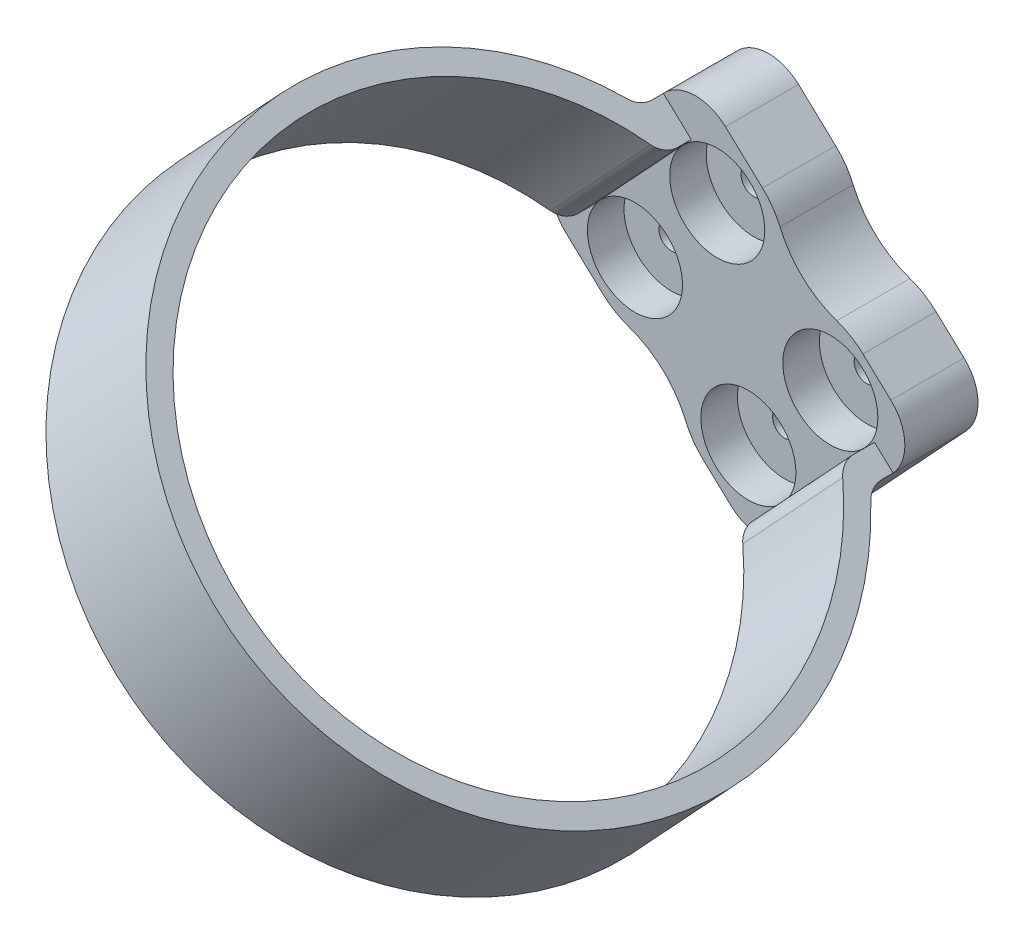
from build123d import *
from build123d.topology import SkipClean

# Parameters (mm, degrees)
BOSS_EXTRUDE2_DEPTH            = 10
SKETCH3_R                      = 40
SKETCH3_R_2                    = 37
BOSS_EXTRUDE3_DEPTH            = 20.040152
CUT_EXTRUDE1_REACH             = 115.803
CUT_EXTRUDE1_END_RADIUS        = 37
SKETCH5_R                      = 1.74703634
SKETCH5_R_2                    = 1.683355043
SKETCH10_W                     = 30.914979244
SKETCH10_H                     = 10
BOSS_EXTRUDE8_DEPTH            = 6
SKETCH11_W                     = 30.914979244
SKETCH11_H                     = 10
BOSS_EXTRUDE9_DEPTH            = 6
SKETCH12_W                     = 10
SKETCH12_H                     = 32.040152213
BOSS_EXTRUDE10_DEPTH           = 6
SKETCH13_W                     = 10
SKETCH13_H                     = 32.040152213
BOSS_EXTRUDE11_DEPTH           = 6
FILLET3_R                      = 6
BOSS_EXTRUDE12_REACH           = 108.364
BOSS_EXTRUDE13_REACH           = 108.364
SKETCH17_R                     = 6.5
CUT_EXTRUDE3_DEPTH             = 5
CUT_EXTRUDE3_DIRECTION_2_REACH = 108.364
CUT_EXTRUDE4_REACH             = 108.364
CUT_EXTRUDE4_END_RADIUS        = 37
FILLET4_R                      = 3
CUT_EXTRUDE5_REACH             = 115.803
FILLET5_R                      = 10


with BuildPart() as part:
    # Sketch1 → Boss-Extrude2 (new body)
    with BuildSketch(Plane.XY):
        Polygon((-3.075119388, 21.362598398), (19.547102475, 0.291978577), (33.205802521, 14.956480402), (10.583580658, 36.027100222), align=None)
    extrude(amount=BOSS_EXTRUDE2_DEPTH)

    # Sketch3 → Boss-Extrude3 (add)
    with BuildSketch(Plane(origin=(22.884598517, 24.569778644, 0), x_dir=(-0.7317560100777086, 0.6815666817818727, 0), z_dir=(0.6815666817818727, 0.7317560100777086, 0))):
        with Locations((1.352782776, 46.892628188)):
            Circle(SKETCH3_R)
        with Locations((1.352782776, 46.892628188)):
            Circle(SKETCH3_R_2, mode=Mode.SUBTRACT)
    extrude(amount=-BOSS_EXTRUDE3_DEPTH)

    # Cut-Extrude1: up to this cylinder (the profile starts outside it)
    cut_extrude1_end = Plane(origin=(15.043707154, 18.136311869, 46.892628188), z_dir=(0.6815666817818727, 0.7317560100777086, 0)) * Cylinder(CUT_EXTRUDE1_END_RADIUS, 323.139339437, mode=Mode.PRIVATE)
    # Sketch5 → Cut-Extrude1 (cut, up to the surface)
    with BuildSketch(Plane(origin=(0, 0, 0), x_dir=(-1, 0, 0), z_dir=(0, 0, -1)), mode=Mode.PRIVATE) as cut_extrude1_sk1:
        with Locations((-13.552748015, 30.82203985)):
            Circle(SKETCH5_R)
    cut_extrude1_tool1 = extrude(cut_extrude1_sk1.sketch, amount=-CUT_EXTRUDE1_REACH, mode=Mode.PRIVATE) - cut_extrude1_end
    add(cut_extrude1_tool1.solids().sort_by_distance((13.552748, 30.82204, 0))[0], mode=Mode.SUBTRACT)
    # Sketch5 → Cut-Extrude1 (cut, up to the surface)
    with BuildSketch(Plane(origin=(0, 0, 0), x_dir=(-1, 0, 0), z_dir=(0, 0, -1)), mode=Mode.PRIVATE) as cut_extrude1_sk2:
        with Locations((-2.306822594, 18.748043967)):
            Circle(SKETCH5_R)
    cut_extrude1_tool2 = extrude(cut_extrude1_sk2.sketch, amount=-CUT_EXTRUDE1_REACH, mode=Mode.PRIVATE) - cut_extrude1_end
    add(cut_extrude1_tool2.solids().sort_by_distance((2.306823, 18.748044, 0))[0], mode=Mode.SUBTRACT)
    # Sketch5 → Cut-Extrude1 (cut, up to the surface)
    with BuildSketch(Plane(origin=(0, 0, 0), x_dir=(-1, 0, 0), z_dir=(0, 0, -1)), mode=Mode.PRIVATE) as cut_extrude1_sk3:
        with Locations((-17.810962495, 4.261826269)):
            Circle(SKETCH5_R_2)
    cut_extrude1_tool3 = extrude(cut_extrude1_sk3.sketch, amount=-CUT_EXTRUDE1_REACH, mode=Mode.PRIVATE) - cut_extrude1_end
    add(cut_extrude1_tool3.solids().sort_by_distance((17.810962, 4.261826, 0))[0], mode=Mode.SUBTRACT)
    # Sketch5 → Cut-Extrude1 (cut, up to the surface)
    with BuildSketch(Plane(origin=(0, 0, 0), x_dir=(-1, 0, 0), z_dir=(0, 0, -1)), mode=Mode.PRIVATE) as cut_extrude1_sk4:
        with Locations((-29.017899523, 16.394033311)):
            Circle(SKETCH5_R)
    cut_extrude1_tool4 = extrude(cut_extrude1_sk4.sketch, amount=-CUT_EXTRUDE1_REACH, mode=Mode.PRIVATE) - cut_extrude1_end
    add(cut_extrude1_tool4.solids().sort_by_distance((29.0179, 16.394033, 0))[0], mode=Mode.SUBTRACT)

    # Sketch10 → Boss-Extrude8 (add)
    with BuildSketch(Plane(origin=(9.22589847, 9.905276819, 0), x_dir=(0.7317560100777085, -0.6815666817818729, 0), z_dir=(-0.6815666817818729, -0.7317560100777085, 0))):
        with Locations((-1.352782776, 5)):
            Rectangle(SKETCH10_W, SKETCH10_H)
    extrude(amount=BOSS_EXTRUDE8_DEPTH)

    # Sketch11 → Boss-Extrude9 (add)
    with BuildSketch(Plane(origin=(22.884598517, 24.569778644, 0), x_dir=(0.7317560100777083, -0.681566681781873, 0), z_dir=(0.681566681781873, 0.7317560100777083, 0))):
        with Locations((-1.352782776, -5)):
            Rectangle(SKETCH11_W, SKETCH11_H)
    extrude(amount=BOSS_EXTRUDE9_DEPTH)

    # Sketch12 → Boss-Extrude10 (add)
    with BuildSketch(Plane(origin=(-12.301017858, 11.457321578, 0), x_dir=(0, 0, 1), z_dir=(-0.7317560100777086, 0.6815666817818726, 0))):
        with Locations((5, 23.556386958)):
            Rectangle(SKETCH12_W, SKETCH12_H)
    extrude(amount=BOSS_EXTRUDE10_DEPTH)

    # Sketch13 → Boss-Extrude11 (add)
    with BuildSketch(Plane(origin=(10.321204005, -9.613298242, 0), x_dir=(0, 0, -1), z_dir=(0.7317560100777092, -0.6815666817818721, 0))):
        with Locations((-5, 23.556386958)):
            Rectangle(SKETCH13_W, SKETCH13_H)
    extrude(amount=BOSS_EXTRUDE11_DEPTH)

    # Fillet3
    fillet3_edges = [part.edges().sort_by_distance(p)[0] for p in [
        (10.282444688, 44.507036374, 5),
        (-11.555055539, 21.061462428, 5),
        (41.685738672, 15.257616372, 5),
        (19.848238445, -8.187957574, 5),
    ]]
    fillet(fillet3_edges, radius=FILLET3_R)

    # Sketch15 → Boss-Extrude12 (add, up to next)
    with BuildSketch(Plane.XY.offset(10), mode=Mode.PRIVATE) as boss_extrude12_sk1:
        Polygon((19.547102475, 0.291978577), (23.937638536, -3.797421514), (37.596338582, 10.867080311), (33.205802521, 14.956480402), align=None)
    boss_extrude12_tool1 = extrude(boss_extrude12_sk1.sketch, amount=BOSS_EXTRUDE12_REACH, mode=Mode.PRIVATE) - part.part
    add(boss_extrude12_tool1.solids().sort_by_distance((28.571721, 5.579529, 10))[0])

    # Sketch16 → Boss-Extrude13 (add, up to next)
    with BuildSketch(Plane.XY.offset(10), mode=Mode.PRIVATE) as boss_extrude13_sk1:
        Polygon((10.583580658, 36.027100222), (6.193044598, 40.116500313), (-7.465655449, 25.451998488), (-3.075119388, 21.362598398), align=None)
    boss_extrude13_tool1 = extrude(boss_extrude13_sk1.sketch, amount=BOSS_EXTRUDE13_REACH, mode=Mode.PRIVATE) - part.part
    add(boss_extrude13_tool1.solids().sort_by_distance((1.558963, 30.739549, 10))[0])

    # Sketch17 → Cut-Extrude3 (cut)
    with BuildSketch(Plane.XY.offset(10)):
        with Locations(Location((2.306822594, 18.748043967, 0), (0, 0, 152.697494073))):
            Circle(SKETCH17_R)
        with Locations(Location((13.552748015, 30.82203985, 0), (0, 0, 121.093351503))):
            Circle(SKETCH17_R)
        with Locations(Location((17.810962495, 4.261826269, 0), (0, 0, 152.393126662))):
            Circle(SKETCH17_R)
        with Locations(Location((29.017899523, 16.394033311, 0), (0, 0, 120.935167822))):
            Circle(SKETCH17_R)
    extrude(amount=-CUT_EXTRUDE3_DEPTH, mode=Mode.SUBTRACT)

    # Sketch17 → Cut-Extrude3 direction 2 (cut, up to next)
    with BuildSketch(Plane.XY.offset(10), mode=Mode.PRIVATE) as cut_extrude3_direction_2_sk1:
        with Locations(Location((2.306822594, 18.748043967, 0), (0, 0, 152.697494073))):
            Circle(SKETCH17_R)
    cut_extrude3_direction_2_tool1 = extrude(cut_extrude3_direction_2_sk1.sketch, amount=CUT_EXTRUDE3_DIRECTION_2_REACH, mode=Mode.PRIVATE) & part.part
    # Sketch17 → Cut-Extrude3 direction 2 (cut, up to next)
    with BuildSketch(Plane.XY.offset(10), mode=Mode.PRIVATE) as cut_extrude3_direction_2_sk2:
        with Locations(Location((13.552748015, 30.82203985, 0), (0, 0, 121.093351503))):
            Circle(SKETCH17_R)
    cut_extrude3_direction_2_tool2 = extrude(cut_extrude3_direction_2_sk2.sketch, amount=CUT_EXTRUDE3_DIRECTION_2_REACH, mode=Mode.PRIVATE) & part.part
    # Sketch17 → Cut-Extrude3 direction 2 (cut, up to next)
    with BuildSketch(Plane.XY.offset(10), mode=Mode.PRIVATE) as cut_extrude3_direction_2_sk3:
        with Locations(Location((17.810962495, 4.261826269, 0), (0, 0, 152.393126662))):
            Circle(SKETCH17_R)
    cut_extrude3_direction_2_tool3 = extrude(cut_extrude3_direction_2_sk3.sketch, amount=CUT_EXTRUDE3_DIRECTION_2_REACH, mode=Mode.PRIVATE) & part.part
    # Sketch17 → Cut-Extrude3 direction 2 (cut, up to next)
    with BuildSketch(Plane.XY.offset(10), mode=Mode.PRIVATE) as cut_extrude3_direction_2_sk4:
        with Locations(Location((29.017899523, 16.394033311, 0), (0, 0, 120.935167822))):
            Circle(SKETCH17_R)
    cut_extrude3_direction_2_tool4 = extrude(cut_extrude3_direction_2_sk4.sketch, amount=CUT_EXTRUDE3_DIRECTION_2_REACH, mode=Mode.PRIVATE) & part.part
    add(cut_extrude3_direction_2_tool1.solids().sort_by_distance((2.306823, 18.748044, 10))[0], mode=Mode.SUBTRACT)
    add(cut_extrude3_direction_2_tool2.solids().sort_by_distance((13.552748, 30.82204, 10))[0], mode=Mode.SUBTRACT)
    add(cut_extrude3_direction_2_tool3.solids().sort_by_distance((17.810962, 4.261826, 10))[0], mode=Mode.SUBTRACT)
    add(cut_extrude3_direction_2_tool4.solids().sort_by_distance((29.0179, 16.394033, 10))[0], mode=Mode.SUBTRACT)

    # Cut-Extrude4: up to this cylinder (the profile starts outside it)
    with SkipClean():  # the faces are left unmerged after this step: merging them gives an invalid solid
        cut_extrude4_end = Plane(origin=(15.133329832, 18.232534198, 46.892628188), z_dir=(0.6815666817818727, 0.7317560100777086, 0)) * Cylinder(CUT_EXTRUDE4_END_RADIUS, 291.728, mode=Mode.PRIVATE)
        # Sketch18 → Cut-Extrude4 (cut, up to the surface)
        with BuildSketch(Plane.XY.offset(10), mode=Mode.PRIVATE) as cut_extrude4_sk1:
            Polygon((21.393947235, -1.428195685), (-3.645697664, 21.894042126), (10.148979711, 36.704534402), (35.18862461, 13.382296591), align=None)
        cut_extrude4_tool1 = extrude(cut_extrude4_sk1.sketch, amount=CUT_EXTRUDE4_REACH, mode=Mode.PRIVATE) - cut_extrude4_end
        add(cut_extrude4_tool1.solids().sort_by_distance((15.771463, 17.638169, 10))[0], mode=Mode.SUBTRACT)
        add(cut_extrude4_tool1.solids().sort_by_distance((15.771463, 17.638169, 10))[1], mode=Mode.SUBTRACT)
    add(part.part.scale(1), mode=Mode.REPLACE)  # the faces are merged on a copy

    # Fillet4
    fillet4_edges = [part.edges().sort_by_distance(p)[0] for p in [
        (30.766988562, 3.534829402, 13.135019577),
        (-0.636305422, 32.784249404, 13.135019577),
        (3.18365236, 29.226293038, 13.645787353),
        (28.223297258, 5.904055227, 14.555786818),
    ]]
    fillet(fillet4_edges, radius=FILLET4_R)

    # Sketch19 → Cut-Extrude5 (cut, up to next)
    with BuildSketch(Plane(origin=(0, 0, 0), x_dir=(-1, 0, 0), z_dir=(0, 0, -1)), mode=Mode.PRIVATE) as cut_extrude5_sk1:
        with BuildLine():
            Line((-31.678269443, 24.578698129), (-21.538760737, 34.022763101))
            ThreePointArc((-21.538760737, 34.022763101), (-25.245381726, 27.837218595), (-31.678269443, 24.578698129))
        make_face()
    cut_extrude5_tool1 = extrude(cut_extrude5_sk1.sketch, amount=-CUT_EXTRUDE5_REACH, mode=Mode.PRIVATE) & part.part
    # Sketch19 → Cut-Extrude5 (cut, up to next)
    with BuildSketch(Plane(origin=(0, 0, 0), x_dir=(-1, 0, 0), z_dir=(0, 0, -1)), mode=Mode.PRIVATE) as cut_extrude5_sk2:
        with BuildLine():
            Line((0.30653048, 10.58444578), (-9.832978226, 1.140380807))
            ThreePointArc((-9.832978226, 1.140380807), (-6.126357236, 7.325925314), (0.30653048, 10.58444578))
        make_face()
    cut_extrude5_tool2 = extrude(cut_extrude5_sk2.sketch, amount=-CUT_EXTRUDE5_REACH, mode=Mode.PRIVATE) & part.part
    add(cut_extrude5_tool1.solids().sort_by_distance((26.059499, 28.711286, 0))[0], mode=Mode.SUBTRACT)
    add(cut_extrude5_tool2.solids().sort_by_distance((5.31224, 6.451858, 0))[0], mode=Mode.SUBTRACT)

    # Fillet5
    fillet5_edges = [part.edges().sort_by_distance(p)[0] for p in [
        (21.538760737, 34.022763101, 5),
        (31.678269443, 24.578698129, 5),
        (9.832978226, 1.140380807, 5),
        (-0.30653048, 10.58444578, 5),
    ]]
    fillet(fillet5_edges, radius=FILLET5_R)


solid = part.part
